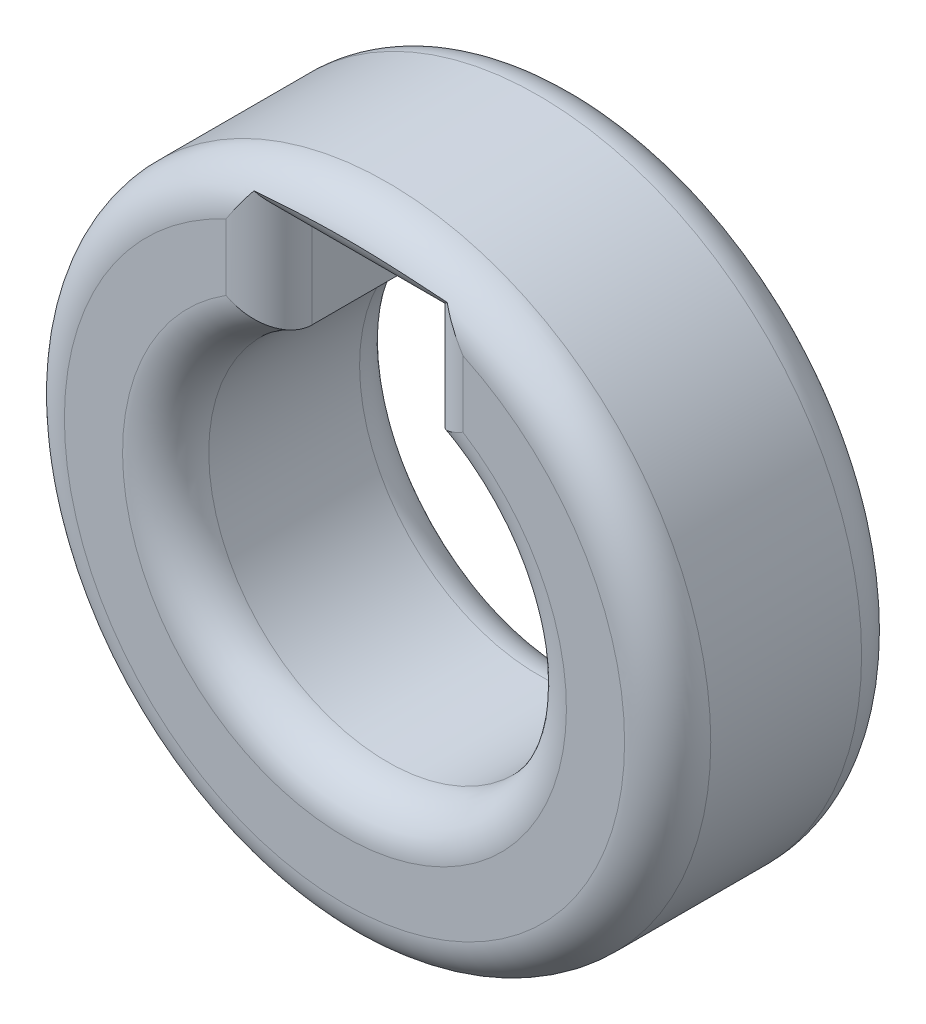
from build123d import *

# Parameters (mm, degrees)
SKIZZE1_R                       = 7.5
AUFSATZ_LINEAR_AUSTRAGEN1_DEPTH = 5.5
VERRUNDUNG1_R                   = 1


with BuildPart() as part:
    # Skizze1 → Aufsatz-Linear austragen1 (new body)
    with BuildSketch(Plane.XY):
        Circle(SKIZZE1_R)
        with BuildLine():
            ThreePointArc((4.15, -1.02e-15), (-2.2315913604421826, -3.498928407384154), (-1.749999999999914, 3.762977544445396))
            Line((-1.75, 3.762977544445424), (-1.75, 6.15))
            Line((-1.75, 6.150000000000001), (1.75, 6.150000000000001))
            Line((1.75, 6.15), (1.75, 3.7629775444453486))
            ThreePointArc((1.7500000000000098, 3.7629775444453517), (3.498928407384184, 2.2315913604421356), (4.15, 0))
        make_face(mode=Mode.SUBTRACT)
    extrude(amount=AUFSATZ_LINEAR_AUSTRAGEN1_DEPTH)

    # Verrundung1
    # the kernel refuses this fillet: 1 mm, written as the material it takes off along each edge
    with BuildSketch(Plane(origin=(-1.75, 1.2629775444454236, 5.5), x_dir=(-1, 0, 0), z_dir=(0, 1, 0))) as verrundung1_piece_1:
        with BuildLine():
            CenterArc((VERRUNDUNG1_R, -VERRUNDUNG1_R), VERRUNDUNG1_R, 90, 90)
            Line((0, -VERRUNDUNG1_R), (0, 0))
            Line((0, 0), (VERRUNDUNG1_R, 0))
        make_face()
    extrude(amount=4.887022455554577, mode=Mode.SUBTRACT)
    with BuildSketch(Plane(origin=(-1.75, 6.150000000000001, 5.5), x_dir=(0, 1, 0), z_dir=(1, 0, 0))) as verrundung1_piece_2:
        with BuildLine():
            CenterArc((VERRUNDUNG1_R, -VERRUNDUNG1_R), VERRUNDUNG1_R, 90, 90)
            Line((0, -VERRUNDUNG1_R), (0, 0))
            Line((0, 0), (VERRUNDUNG1_R, 0))
        make_face()
    extrude(amount=3.5, mode=Mode.SUBTRACT)
    with BuildSketch(Plane(origin=(1.75, 6.15, 5.5), x_dir=(1, 0, 0), z_dir=(0, -1, 0))) as verrundung1_piece_3:
        with BuildLine():
            CenterArc((VERRUNDUNG1_R, -VERRUNDUNG1_R), VERRUNDUNG1_R, 90, 90)
            Line((0, -VERRUNDUNG1_R), (0, 0))
            Line((0, 0), (VERRUNDUNG1_R, 0))
        make_face()
    extrude(amount=4.887022455554652, mode=Mode.SUBTRACT)
    with BuildSketch(Plane(origin=(0, 0, 5.5), x_dir=(1, 0, 0), z_dir=(0, -1, 0))) as verrundung1_piece_4:
        with BuildLine():
            CenterArc((7.5 - VERRUNDUNG1_R, -VERRUNDUNG1_R), VERRUNDUNG1_R, 0, 90)
            Line((7.5 - VERRUNDUNG1_R, 0), (7.5, 0))
            Line((7.5, 0), (7.5, -VERRUNDUNG1_R))
        make_face()
    revolve(axis=Axis((0, 0, 5.5), (0, 0, 1)), mode=Mode.SUBTRACT)
    with BuildSketch(Plane(origin=(-6e-17, 3.3e-16, 5.5), x_dir=(-0.0031415874858718097, 0.9999950652018581, 0), z_dir=(0.9999950652018581, 0.0031415874858718097, 0))) as verrundung1_piece_5:
        with BuildLine():
            CenterArc((4.1499999999999995 + VERRUNDUNG1_R, -VERRUNDUNG1_R), VERRUNDUNG1_R, 90, 90)
            Line((4.1499999999999995, -VERRUNDUNG1_R), (4.1499999999999995, 0))
            Line((4.1499999999999995, 0), (4.1499999999999995 + VERRUNDUNG1_R, 0))
        make_face()
    revolve(axis=Axis((-6e-17, 3.3e-16, 5.5), (0, 0, 1)), revolution_arc=359.64, mode=Mode.SUBTRACT)
    with BuildSketch(Plane(origin=(0, 0, 0), x_dir=(1, 0, 0), z_dir=(0, -1, 0))) as verrundung1_piece_6:
        with BuildLine():
            CenterArc((7.5 - VERRUNDUNG1_R, VERRUNDUNG1_R), VERRUNDUNG1_R, 270, 90)
            Line((7.5 - VERRUNDUNG1_R, -1.1e-16), (7.5, 0))
            Line((7.5, 0), (7.5, VERRUNDUNG1_R))
        make_face()
    revolve(axis=Axis((0, 0, 0), (0, 0, 1)), mode=Mode.SUBTRACT)
    with BuildSketch(Plane(origin=(1.75, 6.15, 0), x_dir=(0, 0, 1), z_dir=(0, -1, 0))) as verrundung1_piece_7:
        with BuildLine():
            CenterArc((VERRUNDUNG1_R, -VERRUNDUNG1_R), VERRUNDUNG1_R, 90, 90)
            Line((-1.1e-16, -VERRUNDUNG1_R), (0, 0))
            Line((0, 0), (VERRUNDUNG1_R, 0))
        make_face()
    extrude(amount=4.887022455554652, mode=Mode.SUBTRACT)
    with BuildSketch(Plane(origin=(-1.75, 6.150000000000001, 0), x_dir=(0, 0, 1), z_dir=(1, 0, 0))) as verrundung1_piece_8:
        with BuildLine():
            CenterArc((VERRUNDUNG1_R, -VERRUNDUNG1_R), VERRUNDUNG1_R, 90, 90)
            Line((-1.1e-16, -VERRUNDUNG1_R), (0, 0))
            Line((0, 0), (VERRUNDUNG1_R, 0))
        make_face()
    extrude(amount=3.5, mode=Mode.SUBTRACT)
    with BuildSketch(Plane(origin=(-1.75, 1.2629775444454236, 0), x_dir=(0, 0, 1), z_dir=(0, 1, 0))) as verrundung1_piece_9:
        with BuildLine():
            CenterArc((VERRUNDUNG1_R, -VERRUNDUNG1_R), VERRUNDUNG1_R, 90, 90)
            Line((-1.1e-16, -VERRUNDUNG1_R), (0, 0))
            Line((0, 0), (VERRUNDUNG1_R, 0))
        make_face()
    extrude(amount=4.887022455554577, mode=Mode.SUBTRACT)
    with BuildSketch(Plane(origin=(1.55e-15, 1e-15, 0), x_dir=(0.0031415874858877553, 0.9999950652018581, 0), z_dir=(-0.9999950652018581, 0.0031415874858877553, 0))) as verrundung1_piece_10:
        with BuildLine():
            CenterArc((4.149999999999999 + VERRUNDUNG1_R, -VERRUNDUNG1_R), VERRUNDUNG1_R, 90, 90)
            Line((4.149999999999999 + VERRUNDUNG1_R, 1.1e-16), (4.149999999999999, 0))
            Line((4.149999999999999, 0), (4.149999999999999, -VERRUNDUNG1_R))
        make_face()
    revolve(axis=Axis((1.55e-15, 1e-15, 0), (0, 0, -1)), revolution_arc=359.64, mode=Mode.SUBTRACT)
    with BuildSketch(Plane(origin=(-1.75, 1.2629775444454236, 5.5), x_dir=(-1, 0, 0), z_dir=(0, 1, 0))) as verrundung1_piece_11a_section:
        with BuildLine():
            CenterArc((VERRUNDUNG1_R, -VERRUNDUNG1_R), VERRUNDUNG1_R, 90, 90)
            Line((0, -VERRUNDUNG1_R), (0, 0))
            Line((0, 0), (VERRUNDUNG1_R, 0))
        make_face()
    verrundung1_piece_11a = extrude(amount=7.387022455554577, mode=Mode.PRIVATE)
    verrundung1_piece_11a = verrundung1_piece_11a & Plane(origin=(0, 0, 5.5), x_dir=(1, 0, 0), z_dir=(0, 0, -1)) * Cylinder(7.5, 19, mode=Mode.PRIVATE)
    verrundung1_piece_11a = split(verrundung1_piece_11a, bisect_by=Plane(origin=(-1.75, 6.15, 5.5), z_dir=(0, 1, 0)), keep=Keep.TOP, mode=Mode.PRIVATE)
    with BuildSketch(Plane(origin=(-4.25, 6.150000000000001, 5.5), x_dir=(0, 1, 0), z_dir=(1, 0, 0))) as verrundung1_piece_11b_section:
        with BuildLine():
            CenterArc((VERRUNDUNG1_R, -VERRUNDUNG1_R), VERRUNDUNG1_R, 90, 90)
            Line((0, -VERRUNDUNG1_R), (0, 0))
            Line((0, 0), (VERRUNDUNG1_R, 0))
        make_face()
    verrundung1_piece_11b = extrude(amount=6, mode=Mode.PRIVATE)
    verrundung1_piece_11b = verrundung1_piece_11b & Plane(origin=(0, 0, 5.5), x_dir=(1, 0, 0), z_dir=(0, 0, -1)) * Cylinder(7.5, 16, mode=Mode.PRIVATE)
    verrundung1_piece_11b = split(verrundung1_piece_11b, bisect_by=Plane(origin=(-1.75, 6.150000000000001, 5.5), z_dir=(-1, 0, 0)), keep=Keep.TOP, mode=Mode.PRIVATE)
    verrundung1_piece_11 = verrundung1_piece_11a & verrundung1_piece_11b
    add(verrundung1_piece_11, mode=Mode.SUBTRACT)
    with BuildSketch(Plane(origin=(-1.75, 6.150000000000001, 5.5), x_dir=(0, 1, 0), z_dir=(1, 0, 0))) as verrundung1_piece_12a_section:
        with BuildLine():
            CenterArc((VERRUNDUNG1_R, -VERRUNDUNG1_R), VERRUNDUNG1_R, 90, 90)
            Line((0, -VERRUNDUNG1_R), (0, 0))
            Line((0, 0), (VERRUNDUNG1_R, 0))
        make_face()
    verrundung1_piece_12a = extrude(amount=6, mode=Mode.PRIVATE)
    verrundung1_piece_12a = verrundung1_piece_12a & Plane(origin=(0, 0, 5.5), x_dir=(1, 0, 0), z_dir=(0, 0, -1)) * Cylinder(7.5, 16, mode=Mode.PRIVATE)
    verrundung1_piece_12a = split(verrundung1_piece_12a, bisect_by=Plane(origin=(1.75, 6.150000000000001, 5.5), z_dir=(1, 0, 0)), keep=Keep.TOP, mode=Mode.PRIVATE)
    with BuildSketch(Plane(origin=(1.75, 8.65, 5.5), x_dir=(1, 0, 0), z_dir=(0, -1, 0))) as verrundung1_piece_12b_section:
        with BuildLine():
            CenterArc((VERRUNDUNG1_R, -VERRUNDUNG1_R), VERRUNDUNG1_R, 90, 90)
            Line((0, -VERRUNDUNG1_R), (0, 0))
            Line((0, 0), (VERRUNDUNG1_R, 0))
        make_face()
    verrundung1_piece_12b = extrude(amount=7.387022455554652, mode=Mode.PRIVATE)
    verrundung1_piece_12b = verrundung1_piece_12b & Plane(origin=(0, 0, 5.5), x_dir=(1, 0, 0), z_dir=(0, 0, -1)) * Cylinder(7.5, 19, mode=Mode.PRIVATE)
    verrundung1_piece_12b = split(verrundung1_piece_12b, bisect_by=Plane(origin=(1.75, 6.150000000000001, 5.5), z_dir=(0, 1, 0)), keep=Keep.TOP, mode=Mode.PRIVATE)
    verrundung1_piece_12 = verrundung1_piece_12a & verrundung1_piece_12b
    add(verrundung1_piece_12, mode=Mode.SUBTRACT)
    with BuildSketch(Plane(origin=(1.75, 8.65, 0), x_dir=(0, 0, 1), z_dir=(0, -1, 0))) as verrundung1_piece_13a_section:
        with BuildLine():
            CenterArc((VERRUNDUNG1_R, -VERRUNDUNG1_R), VERRUNDUNG1_R, 90, 90)
            Line((-1.1e-16, -VERRUNDUNG1_R), (0, 0))
            Line((0, 0), (VERRUNDUNG1_R, 0))
        make_face()
    verrundung1_piece_13a = extrude(amount=7.387022455554652, mode=Mode.PRIVATE)
    verrundung1_piece_13a = verrundung1_piece_13a & Plane(origin=(0, 0, 0), x_dir=(1, 0, 0), z_dir=(0, 0, -1)) * Cylinder(7.5, 19, mode=Mode.PRIVATE)
    verrundung1_piece_13a = split(verrundung1_piece_13a, bisect_by=Plane(origin=(1.75, 6.150000000000001, 0), z_dir=(0, 1, 0)), keep=Keep.TOP, mode=Mode.PRIVATE)
    with BuildSketch(Plane(origin=(-1.75, 6.150000000000001, 0), x_dir=(0, 0, 1), z_dir=(1, 0, 0))) as verrundung1_piece_13b_section:
        with BuildLine():
            CenterArc((VERRUNDUNG1_R, -VERRUNDUNG1_R), VERRUNDUNG1_R, 90, 90)
            Line((-1.1e-16, -VERRUNDUNG1_R), (0, 0))
            Line((0, 0), (VERRUNDUNG1_R, 0))
        make_face()
    verrundung1_piece_13b = extrude(amount=6, mode=Mode.PRIVATE)
    verrundung1_piece_13b = verrundung1_piece_13b & Plane(origin=(0, 0, 0), x_dir=(1, 0, 0), z_dir=(0, 0, -1)) * Cylinder(7.5, 16, mode=Mode.PRIVATE)
    verrundung1_piece_13b = split(verrundung1_piece_13b, bisect_by=Plane(origin=(1.75, 6.150000000000001, 0), z_dir=(1, 0, 0)), keep=Keep.TOP, mode=Mode.PRIVATE)
    verrundung1_piece_13 = verrundung1_piece_13a & verrundung1_piece_13b
    add(verrundung1_piece_13, mode=Mode.SUBTRACT)
    with BuildSketch(Plane(origin=(-4.25, 6.150000000000001, 0), x_dir=(0, 0, 1), z_dir=(1, 0, 0))) as verrundung1_piece_14a_section:
        with BuildLine():
            CenterArc((VERRUNDUNG1_R, -VERRUNDUNG1_R), VERRUNDUNG1_R, 90, 90)
            Line((-1.1e-16, -VERRUNDUNG1_R), (0, 0))
            Line((0, 0), (VERRUNDUNG1_R, 0))
        make_face()
    verrundung1_piece_14a = extrude(amount=6, mode=Mode.PRIVATE)
    verrundung1_piece_14a = verrundung1_piece_14a & Plane(origin=(0, 0, 0), x_dir=(1, 0, 0), z_dir=(0, 0, -1)) * Cylinder(7.5, 16, mode=Mode.PRIVATE)
    verrundung1_piece_14a = split(verrundung1_piece_14a, bisect_by=Plane(origin=(-1.75, 6.150000000000001, 0), z_dir=(-1, 0, 0)), keep=Keep.TOP, mode=Mode.PRIVATE)
    with BuildSketch(Plane(origin=(-1.75, 1.2629775444454236, 0), x_dir=(0, 0, 1), z_dir=(0, 1, 0))) as verrundung1_piece_14b_section:
        with BuildLine():
            CenterArc((VERRUNDUNG1_R, -VERRUNDUNG1_R), VERRUNDUNG1_R, 90, 90)
            Line((-1.1e-16, -VERRUNDUNG1_R), (0, 0))
            Line((0, 0), (VERRUNDUNG1_R, 0))
        make_face()
    verrundung1_piece_14b = extrude(amount=7.387022455554577, mode=Mode.PRIVATE)
    verrundung1_piece_14b = verrundung1_piece_14b & Plane(origin=(0, 0, 0), x_dir=(1, 0, 0), z_dir=(0, 0, -1)) * Cylinder(7.5, 19, mode=Mode.PRIVATE)
    verrundung1_piece_14b = split(verrundung1_piece_14b, bisect_by=Plane(origin=(-1.75, 6.15, 0), z_dir=(0, 1, 0)), keep=Keep.TOP, mode=Mode.PRIVATE)
    verrundung1_piece_14 = verrundung1_piece_14a & verrundung1_piece_14b
    add(verrundung1_piece_14, mode=Mode.SUBTRACT)


solid = part.part
